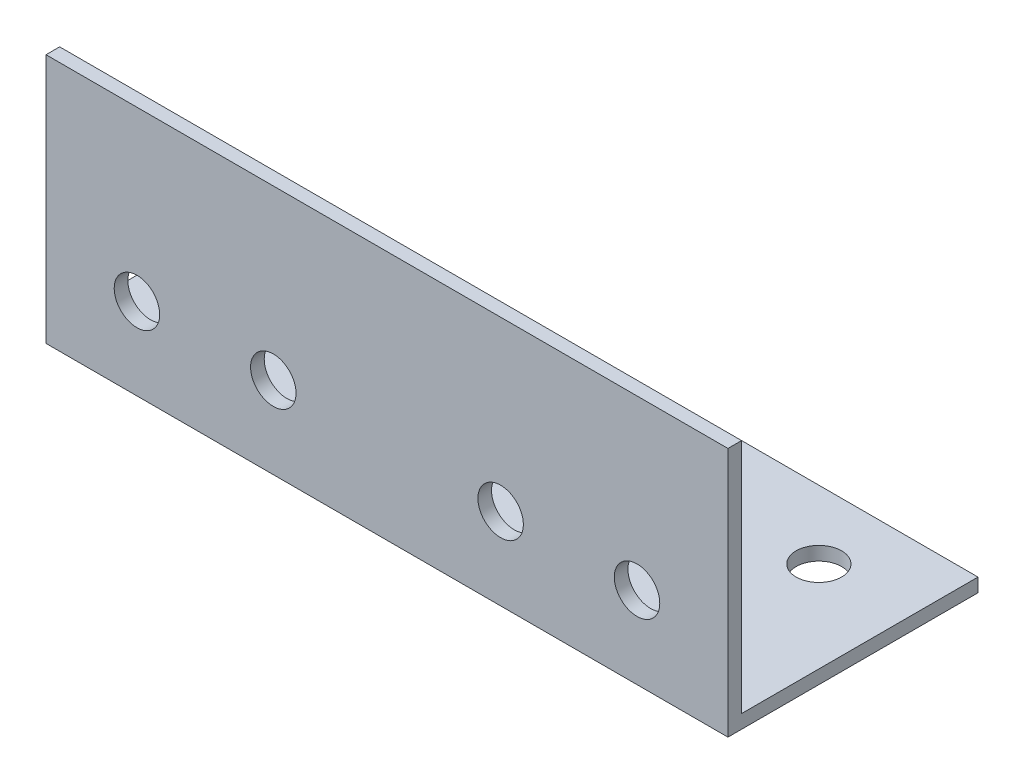
from build123d import *

# Parameters (mm, degrees)
EXTRUDE_1_DEPTH     = 150
SKETCH_2_R          = 5
CUT_EXTRUDE_1_DEPTH = 169.967452487
SKETCH_3_R          = 5
CUT_EXTRUDE_3_DEPTH = 169.967452487


with BuildPart() as part:
    # Эскиз1 → Вытянуть-Тонкостенный1 (new body)
    with BuildSketch(Plane(origin=(0, 0, 0), x_dir=(0, 0, -1), z_dir=(1, 0, 0))):
        Polygon((55, 0), (0, 0), (0, 55), (3, 55), (3, 3), (55, 3), align=None)
    extrude(amount=EXTRUDE_1_DEPTH)

    # Эскиз2 → Вырез-Вытянуть1 (cut, through all)
    with BuildSketch(Plane.XZ):
        with Locations((130, -40)):
            Circle(SKETCH_2_R)
        with Locations((100, -40)):
            Circle(SKETCH_2_R)
        with Locations((50, -40)):
            Circle(SKETCH_2_R)
        with Locations((20, -40)):
            Circle(SKETCH_2_R)
    extrude(amount=-CUT_EXTRUDE_1_DEPTH, mode=Mode.SUBTRACT)

    # Эскиз3 → Вырез-Вытянуть3 (cut, through all)
    with BuildSketch(Plane.XY):
        with Locations((130, 18)):
            Circle(SKETCH_3_R)
        with Locations((100, 18)):
            Circle(SKETCH_3_R)
        with Locations((50, 18)):
            Circle(SKETCH_3_R)
        with Locations((20, 18)):
            Circle(SKETCH_3_R)
    extrude(amount=-CUT_EXTRUDE_3_DEPTH, mode=Mode.SUBTRACT)


solid = part.part
